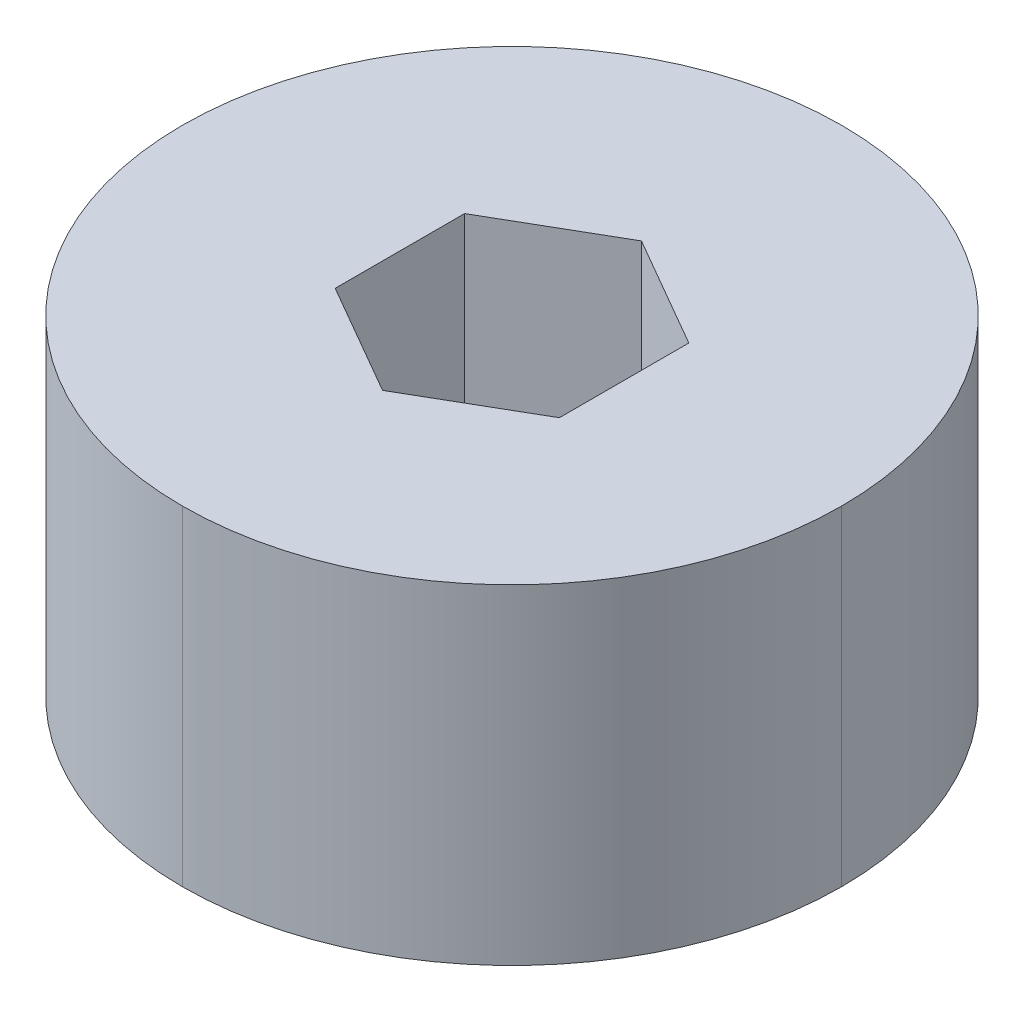
from build123d import *

# Parameters (mm, degrees)
SKETCH1_W           = 20
SKETCH1_H           = 20
BOSS_EXTRUDE1_DEPTH = 10
CUT_EXTRUDE1_DEPTH  = 5
FILLET1_R           = 10


with BuildPart() as part:
    # Sketch1 → Boss-Extrude1 (new body)
    with BuildSketch(Plane(origin=(0, 0, 0), x_dir=(1, 0, 0), z_dir=(0, 1, 0))):
        Rectangle(SKETCH1_W, SKETCH1_H)
    extrude(amount=BOSS_EXTRUDE1_DEPTH)

    # Sketch2 → Cut-Extrude1 (cut)
    with BuildSketch(Plane(origin=(0, 10, 0), x_dir=(1, 0, 0), z_dir=(0, 1, 0))):
        Polygon((0, 3.92598183), (-3.4, 1.962990915), (-3.4, -1.962990915), (0, -3.92598183), (3.4, -1.962990915), (3.4, 1.962990915), align=None)
    extrude(amount=-CUT_EXTRUDE1_DEPTH, mode=Mode.SUBTRACT)

    # Fillet1
    fillet1_edges = [part.edges().sort_by_distance(p)[0] for p in [
        (10, 5, -10),
        (10, 5, 10),
        (-10, 5, -10),
        (-10, 5, 10),
    ]]
    fillet(fillet1_edges, radius=FILLET1_R - 0.0001)  # a hair under: the kernel refuses the full size


solid = part.part
